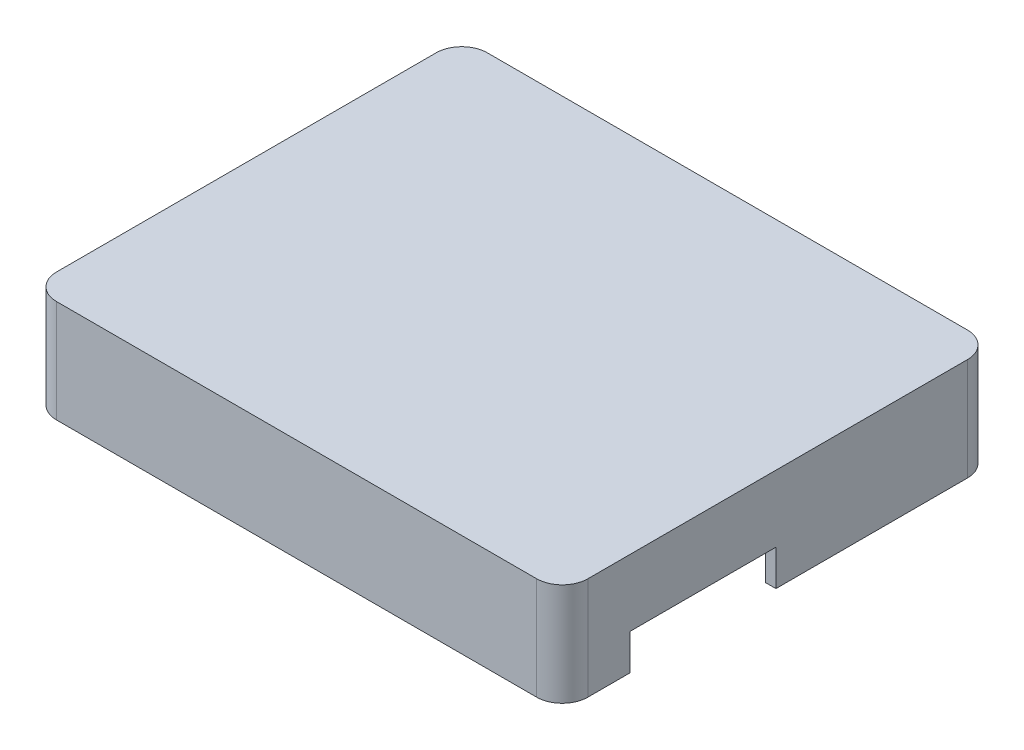
from build123d import *

# Parameters (mm, degrees)
SKETCH5_W           = 65.786
SKETCH5_H           = 53.34
BOSS_EXTRUDE1_DEPTH = 12.7
CUT_EXTRUDE1_DEPTH  = 11.43
FILLET1_R           = 3.175
SKETCH8_W           = 63.246
SKETCH8_H           = 50.8
CUT_EXTRUDE2_DEPTH  = 1.5621
SKETCH9_W           = 15.301638829
SKETCH9_H           = 18.07026672
CUT_EXTRUDE3_DEPTH  = 4.445


with BuildPart() as part:
    # Sketch5 → Boss-Extrude1 (new body)
    with BuildSketch(Plane(origin=(0, 0, 0), x_dir=(1, 0, 0), z_dir=(0, 1, 0))):
        with Locations((-7.078072202, 8.960606498)):
            Rectangle(SKETCH5_W, SKETCH5_H)
    extrude(amount=BOSS_EXTRUDE1_DEPTH)

    # Sketch7 → Cut-Extrude1 (cut)
    with BuildSketch(Plane.XZ):
        with BuildLine():
            Line((-32.033572202, -34.360606498), (17.877427798, -34.360606498))
            ThreePointArc((17.877427798, -34.360606498), (18.77545341, -33.98863211), (19.147427798, -33.090606498))
            Line((19.147427798, -33.090606498), (19.147427798, -31.820606498))
            ThreePointArc((19.147427798, -31.820606498), (19.984370171, -29.800048871), (22.004927798, -28.963106498))
            Line((22.004927798, -28.963106498), (23.274927798, -28.963106498))
            ThreePointArc((23.274927798, -28.963106498), (24.17295341, -28.59113211), (24.544927798, -27.693106498))
            Line((24.544927798, -27.693106498), (24.544927798, 9.771893502))
            ThreePointArc((24.544927798, 9.771893502), (24.17295341, 10.669919114), (23.274927798, 11.041893502))
            Line((23.274927798, 11.041893502), (22.004927798, 11.041893502))
            ThreePointArc((22.004927798, 11.041893502), (19.984370171, 11.878835875), (19.147427798, 13.899393502))
            Line((19.147427798, 13.899393502), (19.147427798, 15.169393502))
            ThreePointArc((19.147427798, 15.169393502), (18.77545341, 16.067419114), (17.877427798, 16.439393502))
            Line((17.877427798, 16.439393502), (-32.033572202, 16.439393502))
            ThreePointArc((-32.033572202, 16.439393502), (-32.931597814, 16.067419114), (-33.303572202, 15.169393502))
            Line((-33.303572202, 15.169393502), (-33.303572202, 13.899393502))
            ThreePointArc((-33.303572202, 13.899393502), (-34.140514575, 11.878835875), (-36.161072202, 11.041893502))
            Line((-36.161072202, 11.041893502), (-37.431072202, 11.041893502))
            ThreePointArc((-37.431072202, 11.041893502), (-38.329097814, 10.669919114), (-38.701072202, 9.771893502))
            Line((-38.701072202, 9.771893502), (-38.701072202, -27.693106498))
            ThreePointArc((-38.701072202, -27.693106498), (-38.329097814, -28.59113211), (-37.431072202, -28.963106498))
            Line((-37.431072202, -28.963106498), (-36.161072202, -28.963106498))
            ThreePointArc((-36.161072202, -28.963106498), (-34.140514575, -29.800048871), (-33.303572202, -31.820606498))
            Line((-33.303572202, -31.820606498), (-33.303572202, -33.090606498))
            ThreePointArc((-33.303572202, -33.090606498), (-32.931597814, -33.98863211), (-32.033572202, -34.360606498))
        make_face()
    extrude(amount=-CUT_EXTRUDE1_DEPTH, mode=Mode.SUBTRACT)

    # Fillet1
    fillet1_edges = [part.edges().sort_by_distance(p)[0] for p in [
        (-39.971072202, 6.35, -35.630606498),
        (25.814927798, 6.35, -35.630606498),
        (25.814927798, 6.35, 17.709393502),
        (-39.971072202, 6.35, 17.709393502),
    ]]
    fillet(fillet1_edges, radius=FILLET1_R)

    # Sketch8 → Cut-Extrude2 (cut)
    with BuildSketch(Plane(origin=(0, 0, 0), x_dir=(1, 0, 0), z_dir=(0, 1, 0))):
        with Locations((-7.078072202, 8.960606498)):
            Rectangle(SKETCH8_W, SKETCH8_H)
    extrude(amount=CUT_EXTRUDE2_DEPTH, mode=Mode.SUBTRACT)

    # Sketch9 → Cut-Extrude3 (cut)
    with BuildSketch(Plane(origin=(0, 0, 0), x_dir=(1, 0, 0), z_dir=(0, 1, 0))):
        with Locations((26.561690875, -0.292260142)):
            Rectangle(SKETCH9_W, SKETCH9_H)
    extrude(amount=CUT_EXTRUDE3_DEPTH, mode=Mode.SUBTRACT)

    # Sketch10 → Tap Drill for #4-40 Tap1 (revolve, cut)
    with BuildSketch(Plane(origin=(-36.161072202, 0, 13.899393502), x_dir=(0, 0, -1), z_dir=(1, 0, 0))):
        Polygon((0, 0), (0, 9.569152758), (1.1303, 8.89), (1.1303, 0), align=None)
    tap_drill_for_4_40_tap1 = revolve(axis=Axis((-36.161072202, -6.35, 13.899393502), (0, 1, 0)), mode=Mode.SUBTRACT)

    # Mirror1: Tap Drill for #4-40 Tap1 across plane
    add(tap_drill_for_4_40_tap1.mirror(Plane(origin=(-7.078072202, 0, 0), x_dir=(0, 0, 1), z_dir=(1, 0, 0))), mode=Mode.SUBTRACT)

    # Mirror2: Tap Drill for #4-40 Tap1 across plane
    add(tap_drill_for_4_40_tap1.mirror(Plane.XY.offset(-8.960606498)), mode=Mode.SUBTRACT)

    # Mirror2 copy 1 sketch → Mirror2 copy 1 (revolve, cut)
    with BuildSketch(Plane(origin=(22.004927798, 0, -31.820606498), x_dir=(0, 0, 1), z_dir=(-1, 0, 0))):
        Polygon((0, 0), (0, 9.569152758), (1.1303, 8.89), (1.1303, 0), align=None)
    revolve(axis=Axis((22.004927798, -6.35, -31.820606498), (0, 1, 0)), mode=Mode.SUBTRACT)


solid = part.part
